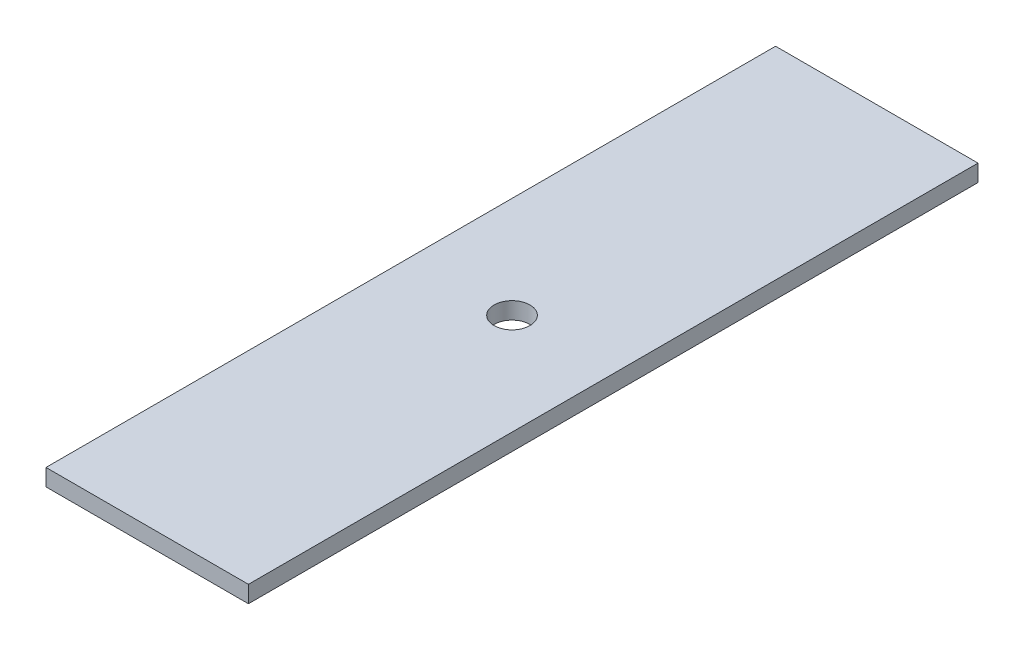
from build123d import *

# Parameters (mm, degrees)
SKETCH1_W           = 76.2
SKETCH1_H           = 274.6375
BOSS_EXTRUDE1_DEPTH = 6.35
SKETCH2_R           = 6.74624
CUT_EXTRUDE1_DEPTH  = 143.647718529


with BuildPart() as part:
    # Sketch1 → Boss-Extrude1 (new body)
    with BuildSketch(Plane(origin=(0, 0, 0), x_dir=(1, 0, 0), z_dir=(0, 1, 0))):
        Rectangle(SKETCH1_W, SKETCH1_H)
    extrude(amount=BOSS_EXTRUDE1_DEPTH)

    # Sketch2 → Cut-Extrude1 (cut, through all)
    with BuildSketch(Plane.XZ):
        Circle(SKETCH2_R)
    extrude(amount=-CUT_EXTRUDE1_DEPTH, mode=Mode.SUBTRACT)


solid = part.part
